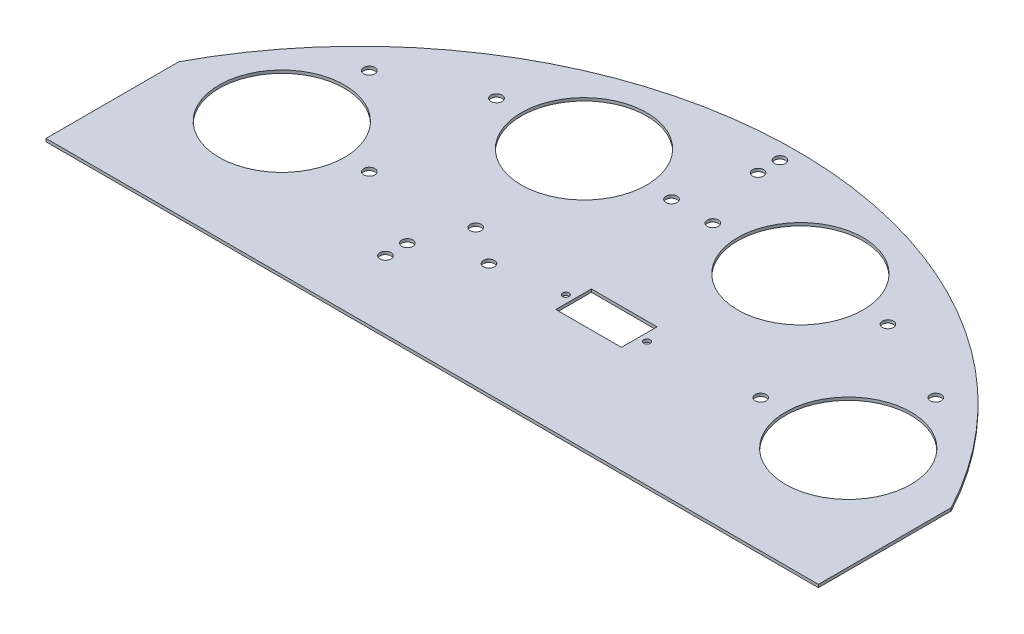
from build123d import *

# Parameters (mm, degrees)
SKETCH3_R             = 21.5
BOSS_EXTRUDE3_DEPTH   = 1
SKETCH10_W            = 22.5
SKETCH10_H            = 12.2
SKETCH10_R            = 1.1
CUT_EXTRUDE3_DEPTH    = 170.731914631
F_6_CLEARANCE_HOLE1_D = 3.7973


with BuildPart() as part:
    # Sketch3 → Boss-Extrude3 (new body)
    with BuildSketch(Plane(origin=(0, 0, 0), x_dir=(1, 0, 0), z_dir=(0, 1, 0))):
        with BuildLine():
            Line((-86.302587142, -18.972612677), (34.565043199, -18.972612677))
            Line((34.565043199, -18.972612677), (86.613577516, -18.972612677))
            Line((86.613577516, -18.972612677), (132.537224892, -18.972612677))
            Line((132.537224892, -18.972612677), (132.537224892, 26.561617598))
            ThreePointArc((132.537224892, 26.561617598), (0.155495187, 106.027387323), (-132.226234517, 26.561617598))
            Line((-132.226234517, 26.561617598), (-132.226234517, -18.972612677))
            Line((-132.226234517, -18.972612677), (-86.302587142, -18.972612677))
        make_face()
        with Locations((-96.926544138, 26.561617598)):
            Circle(SKETCH3_R, mode=Mode.SUBTRACT)
        with Locations((-36.926544138, 70.154169278)):
            Circle(SKETCH3_R, mode=Mode.SUBTRACT)
        with BuildLine():
            ThreePointArc((118.737534512, 26.561617598), (103.881399891, 6.113902497), (79.843669133, 13.924234673))
            ThreePointArc((79.843669133, 13.924234673), (90.593669133, 47.009332698), (118.737534512, 26.561617598))
        make_face(mode=Mode.SUBTRACT)
        with Locations((37.237534512, 70.154169278)):
            Circle(SKETCH3_R, mode=Mode.SUBTRACT)
    extrude(amount=BOSS_EXTRUDE3_DEPTH)

    # Sketch10 → Cut-Extrude3 (cut, through all)
    with BuildSketch(Plane(origin=(0, 0, 0), x_dir=(-1, 0, 0), z_dir=(0, -1, 0))):
        with Locations((-17.176423082, 23.72316033)):
            Rectangle(SKETCH10_W, SKETCH10_H)
        with Locations((-31.076423082, 23.72316033)):
            Circle(SKETCH10_R)
        with Locations((-3.276423082, 23.72316033)):
            Circle(SKETCH10_R)
    extrude(amount=-CUT_EXTRUDE3_DEPTH, mode=Mode.SUBTRACT)

    # #6 Clearance Hole1 (through all)
    with Locations(Plane(origin=(0, 0, 0), x_dir=(-1, 0, 0), z_dir=(0, -1, 0))):
        with Locations((-97.237534512, 56.561617598), (-67.237534512, 26.561617598), (-67.237534512, 70.154169278), (-7.237534512, 70.154169278), (6.926544138, 70.154169278), (66.926544138, 70.154169278), (96.926544138, 56.561617598), (66.926544138, 26.561617598), (-0.03130886, 92.861330123), (-0.026423082, 100.361328532), (39.201365084, 4.37316033), (39.201365084, 11.87316033), (32.142133145, 28.254616687), (19.154347381, 19.79486368)):
            Hole(F_6_CLEARANCE_HOLE1_D / 2)


solid = part.part
